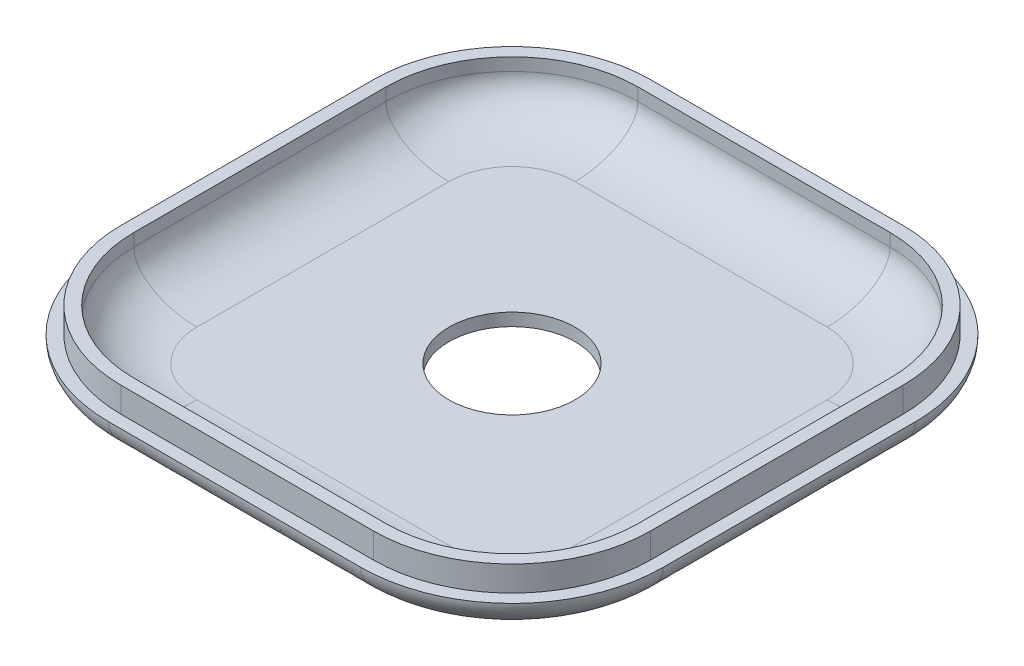
from build123d import *

# Parameters (mm, degrees)
SKETCH1_R           = 5
BOSS_EXTRUDE2_DEPTH = 1
BOSS_EXTRUDE3_DEPTH = 5
BOSS_EXTRUDE4_DEPTH = 3
FILLET1_SIZE        = 5
FILLET1_SIZE_2      = 3
FILLET2_SIZE        = 5
FILLET2_SIZE_2      = 3


with BuildPart() as part:
    # Sketch1 → Boss-Extrude2 (new body)
    with BuildSketch(Plane(origin=(0, 0, 0), x_dir=(1, 0, 0), z_dir=(0, 1, 0))):
        with BuildLine():
            ThreePointArc((10, 0), (2.928932188, 2.928932188), (0, 10))
            Line((0, 10), (0, 30))
            ThreePointArc((0, 30), (2.928932188, 37.071067812), (10, 40))
            Line((10, 40), (30, 40))
            ThreePointArc((30, 40), (37.071067812, 37.071067812), (40, 30))
            Line((40, 30), (40, 10))
            ThreePointArc((40, 10), (37.071067812, 2.928932188), (30, 0))
            Line((30, 0), (10, 0))
        make_face()
        with Locations(Location((20, 20, 0), (0, 0, 270))):
            Circle(SKETCH1_R, mode=Mode.SUBTRACT)
    extrude(amount=BOSS_EXTRUDE2_DEPTH)

    # Sketch1<4> → Boss-Extrude3 (add)
    with BuildSketch(Plane(origin=(0, 0, 0), x_dir=(1, 0, 0), z_dir=(0, 1, 0))):
        with BuildLine():
            ThreePointArc((10, -1), (2.221825407, 2.221825407), (-1, 10))
            Line((-1, 10), (-1, 30))
            ThreePointArc((-1, 30), (2.221825407, 37.778174593), (10, 41))
            Line((10, 41), (30, 41))
            ThreePointArc((30, 41), (37.778174593, 37.778174593), (41, 30))
            Line((41, 30), (41, 10))
            ThreePointArc((41, 10), (37.778174593, 2.221825407), (30, -1))
            Line((30, -1), (10, -1))
        make_face()
        with BuildLine():
            Line((10, 0), (30, 0))
            ThreePointArc((30, 0), (37.071067812, 2.928932188), (40, 10))
            Line((40, 10), (40, 30))
            ThreePointArc((40, 30), (37.071067812, 37.071067812), (30, 40))
            Line((30, 40), (10, 40))
            ThreePointArc((10, 40), (2.928932188, 37.071067812), (0, 30))
            Line((0, 30), (0, 10))
            ThreePointArc((0, 10), (2.928932188, 2.928932188), (10, 0))
        make_face(mode=Mode.SUBTRACT)
    extrude(amount=BOSS_EXTRUDE3_DEPTH)

    # Sketch1<5> → Boss-Extrude4 (add)
    with BuildSketch(Plane(origin=(0, 0, 0), x_dir=(1, 0, 0), z_dir=(0, 1, 0))):
        with BuildLine():
            ThreePointArc((10, -2), (1.514718626, 1.514718626), (-2, 10))
            Line((-2, 10), (-2, 30))
            ThreePointArc((-2, 30), (1.514718626, 38.485281374), (10, 42))
            Line((10, 42), (30, 42))
            ThreePointArc((30, 42), (38.485281374, 38.485281374), (42, 30))
            Line((42, 30), (42, 10))
            ThreePointArc((42, 10), (38.485281374, 1.514718626), (30, -2))
            Line((30, -2), (10, -2))
        make_face()
        with BuildLine():
            Line((10, -1), (30, -1))
            ThreePointArc((30, -1), (37.778174593, 2.221825407), (41, 10))
            Line((41, 10), (41, 30))
            ThreePointArc((41, 30), (37.778174593, 37.778174593), (30, 41))
            Line((30, 41), (10, 41))
            ThreePointArc((10, 41), (2.221825407, 37.778174593), (-1, 30))
            Line((-1, 30), (-1, 10))
            ThreePointArc((-1, 10), (2.221825407, 2.221825407), (10, -1))
        make_face(mode=Mode.SUBTRACT)
    extrude(amount=BOSS_EXTRUDE4_DEPTH)

    # Fillet1
    # an asymmetric fillet: 5, 3 mm, written as the material it adds along each edge
    with BuildSketch(Plane(origin=(10, 1, -10), x_dir=(0, 0, 1), z_dir=(1, 0, 0))) as fillet1_piece_1:
        with BuildLine():
            Bezier((10 - FILLET1_SIZE, 0), (10, 0), (10, -FILLET1_SIZE_2), weights=[1, 0.707106781, 1])
            Line((10, -FILLET1_SIZE_2), (10, 0))
            Line((10, 0), (10 - FILLET1_SIZE, 0))
        make_face()
    revolve(axis=Axis((10, 1, -10), (0, -1, 0)), revolution_arc=90)
    with BuildSketch(Plane(origin=(30, 1, 0), x_dir=(0, 0, -1), z_dir=(-1, 0, 0)), Plane(origin=(40, 1, -30), x_dir=(-1, 0, 0), z_dir=(0, 0, 1)), Plane(origin=(10, 1, -40), x_dir=(0, 0, 1), z_dir=(1, 0, 0)), Plane(origin=(0, 1, -10), x_dir=(1, 0, 0), z_dir=(0, 0, -1))) as fillet1_piece_2:
        with BuildLine():
            Bezier((FILLET1_SIZE, 0), (0, 0), (0, -FILLET1_SIZE_2), weights=[1, 0.707106781, 1])
            Line((0, -FILLET1_SIZE_2), (0, 0))
            Line((0, 0), (FILLET1_SIZE, 0))
        make_face()
    extrude(amount=20)
    with BuildSketch(Plane(origin=(30, 1, -10), x_dir=(1, 0, 0), z_dir=(0, 0, -1))) as fillet1_piece_3:
        with BuildLine():
            Bezier((10 - FILLET1_SIZE, 0), (10, 0), (10, -FILLET1_SIZE_2), weights=[1, 0.707106781, 1])
            Line((10, -FILLET1_SIZE_2), (10, 0))
            Line((10, 0), (10 - FILLET1_SIZE, 0))
        make_face()
    revolve(axis=Axis((30, 1, -10), (0, -1, 0)), revolution_arc=90)
    with BuildSketch(Plane(origin=(30, 1, -30), x_dir=(0, 0, -1), z_dir=(-1, 0, 0))) as fillet1_piece_4:
        with BuildLine():
            Bezier((10 - FILLET1_SIZE, 0), (10, 0), (10, -FILLET1_SIZE_2), weights=[1, 0.707106781, 1])
            Line((10, -FILLET1_SIZE_2), (10, 0))
            Line((10, 0), (10 - FILLET1_SIZE, 0))
        make_face()
    revolve(axis=Axis((30, 1, -30), (0, -1, 0)), revolution_arc=90)
    with BuildSketch(Plane(origin=(10, 1, -30), x_dir=(-1, 0, 0), z_dir=(0, 0, 1))) as fillet1_piece_5:
        with BuildLine():
            Bezier((10 - FILLET1_SIZE, 0), (10, 0), (10, -FILLET1_SIZE_2), weights=[1, 0.707106781, 1])
            Line((10, -FILLET1_SIZE_2), (10, 0))
            Line((10, 0), (10 - FILLET1_SIZE, 0))
        make_face()
    revolve(axis=Axis((10, 1, -30), (0, -1, 0)), revolution_arc=90)

    # Fillet2
    # an asymmetric fillet: 5, 3 mm, written as the material it takes off along each edge
    with BuildSketch(Plane(origin=(10, 0, -42), x_dir=(0, 0, 1), z_dir=(1, 0, 0)), Plane(origin=(-2, 0, -10), x_dir=(1, 0, 0), z_dir=(0, 0, -1)), Plane(origin=(42, 0, -30), x_dir=(-1, 0, 0), z_dir=(0, 0, 1)), Plane(origin=(30, 0, 2), x_dir=(0, 0, -1), z_dir=(-1, 0, 0))) as fillet2_piece_1:
        with BuildLine():
            Bezier((FILLET2_SIZE, 0), (0, 0), (0, -FILLET2_SIZE_2), weights=[1, 0.707106781, 1])
            Line((0, -FILLET2_SIZE_2), (-0.1, -3))
            Line((-0.1, -3), (-0.1, 0.1))
            Line((-0.1, 0.1), (5, 0.1))
            Line((5, 0.1), (FILLET2_SIZE, 0))
        make_face()
    extrude(amount=20, mode=Mode.SUBTRACT)
    with BuildSketch(Plane(origin=(10, 0, -30), x_dir=(-1, 0, 0), z_dir=(0, 0, 1))) as fillet2_piece_2:
        with BuildLine():
            Bezier((12 - FILLET2_SIZE, 0), (12, 0), (12, -FILLET2_SIZE_2), weights=[1, 0.707106781, 1])
            Line((12, -FILLET2_SIZE_2), (12.1, -3))
            Line((12.1, -3), (12.1, 0.1))
            Line((12.1, 0.1), (7, 0.1))
            Line((7, 0.1), (12 - FILLET2_SIZE, 0))
        make_face()
    revolve(axis=Axis((10, 0, -30), (0, -1, 0)), revolution_arc=90, mode=Mode.SUBTRACT)
    with BuildSketch(Plane(origin=(30, 0, -30), x_dir=(0, 0, -1), z_dir=(-1, 0, 0))) as fillet2_piece_3:
        with BuildLine():
            Bezier((12 - FILLET2_SIZE, 0), (12, 0), (12, -FILLET2_SIZE_2), weights=[1, 0.707106781, 1])
            Line((12, -FILLET2_SIZE_2), (12.1, -3))
            Line((12.1, -3), (12.1, 0.1))
            Line((12.1, 0.1), (7, 0.1))
            Line((7, 0.1), (12 - FILLET2_SIZE, 0))
        make_face()
    revolve(axis=Axis((30, 0, -30), (0, -1, 0)), revolution_arc=90, mode=Mode.SUBTRACT)
    with BuildSketch(Plane(origin=(10, 0, -10), x_dir=(0, 0, 1), z_dir=(1, 0, 0))) as fillet2_piece_4:
        with BuildLine():
            Bezier((12 - FILLET2_SIZE, 0), (12, 0), (12, -FILLET2_SIZE_2), weights=[1, 0.707106781, 1])
            Line((12, -FILLET2_SIZE_2), (12.1, -3))
            Line((12.1, -3), (12.1, 0.1))
            Line((12.1, 0.1), (7, 0.1))
            Line((7, 0.1), (12 - FILLET2_SIZE, 0))
        make_face()
    revolve(axis=Axis((10, 0, -10), (0, -1, 0)), revolution_arc=90, mode=Mode.SUBTRACT)
    with BuildSketch(Plane(origin=(30, 0, -10), x_dir=(1, 0, 0), z_dir=(0, 0, -1))) as fillet2_piece_5:
        with BuildLine():
            Bezier((12 - FILLET2_SIZE, 0), (12, 0), (12, -FILLET2_SIZE_2), weights=[1, 0.707106781, 1])
            Line((12, -FILLET2_SIZE_2), (12.1, -3))
            Line((12.1, -3), (12.1, 0.1))
            Line((12.1, 0.1), (7, 0.1))
            Line((7, 0.1), (12 - FILLET2_SIZE, 0))
        make_face()
    revolve(axis=Axis((30, 0, -10), (0, -1, 0)), revolution_arc=90, mode=Mode.SUBTRACT)


solid = part.part
